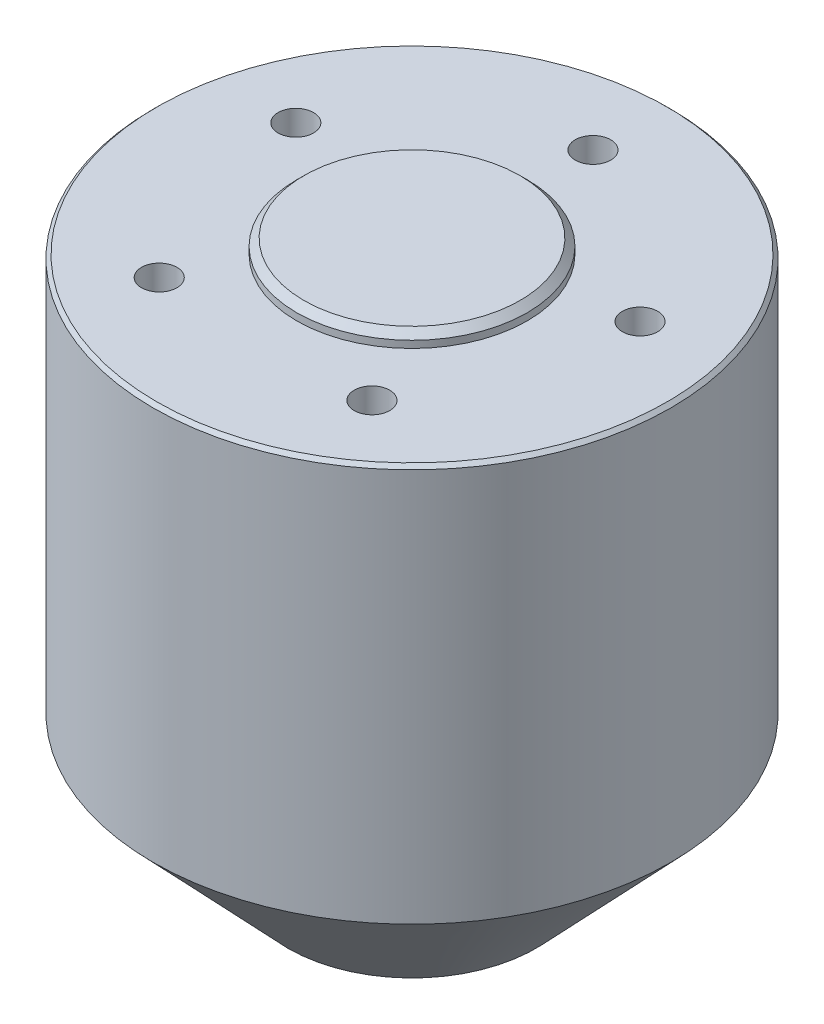
from build123d import *

# Parameters (mm, degrees)
SKETCH1_R           = 36.5
SKETCH1_R_2         = 16.25
BOSS_EXTRUDE1_DEPTH = 76
SKETCH1_3_R         = 16.25
BOSS_EXTRUDE2_DEPTH = 78
SKETCH2_R           = 2.5
CUT_EXTRUDE1_DEPTH  = 7
CHAMFER1_SIZE       = 0.5
CHAMFER3_SIZE       = 1
CHAMFER4_SIZE       = 19
CHAMFER4_SIZE2      = 20


with BuildPart() as part:
    # Sketch1 → Boss-Extrude1 (new body)
    with BuildSketch(Plane(origin=(0, 0, 0), x_dir=(1, 0, 0), z_dir=(0, 1, 0))):
        Circle(SKETCH1_R)
        Circle(SKETCH1_R_2, mode=Mode.SUBTRACT)
    extrude(amount=BOSS_EXTRUDE1_DEPTH)

    # Sketch1<3> → Boss-Extrude2 (add)
    with BuildSketch(Plane(origin=(0, 0, 0), x_dir=(1, 0, 0), z_dir=(0, 1, 0))):
        Circle(SKETCH1_3_R)
    extrude(amount=BOSS_EXTRUDE2_DEPTH)

    # Sketch2 → Cut-Extrude1 (cut)
    with BuildSketch(Plane(origin=(0, 76, 0), x_dir=(1, 0, 0), z_dir=(0, 1, 0))):
        with Locations((0, 25.52)):
            Circle(SKETCH2_R)
        with Locations((24.270962296, 7.886113696)):
            Circle(SKETCH2_R)
        with Locations((15.000279639, -20.646113696)):
            Circle(SKETCH2_R)
        with Locations((-15.000279639, -20.646113696)):
            Circle(SKETCH2_R)
        with Locations((-24.270962296, 7.886113696)):
            Circle(SKETCH2_R)
    extrude(amount=-CUT_EXTRUDE1_DEPTH, mode=Mode.SUBTRACT)

    # Chamfer1
    chamfer1_edges = [part.edges().sort_by_distance(p)[0] for p in [
        (-36.5, 76, 0),
    ]]
    chamfer(chamfer1_edges, length=CHAMFER1_SIZE)

    # Chamfer3
    chamfer3_edges = [part.edges().sort_by_distance(p)[0] for p in [
        (-16.25, 78, 0),
    ]]
    chamfer(chamfer3_edges, length=CHAMFER3_SIZE)

    # Chamfer4
    chamfer4_edges = [part.edges().sort_by_distance(p)[0] for p in [
        (-36.5, 0, 0),
    ]]
    chamfer4_side = [part.faces().sort_by_distance(p)[0] for p in [
        (0, 0, 0),
    ]]
    chamfer(chamfer4_edges, length=CHAMFER4_SIZE, length2=CHAMFER4_SIZE2, reference=chamfer4_side[0])


solid = part.part
